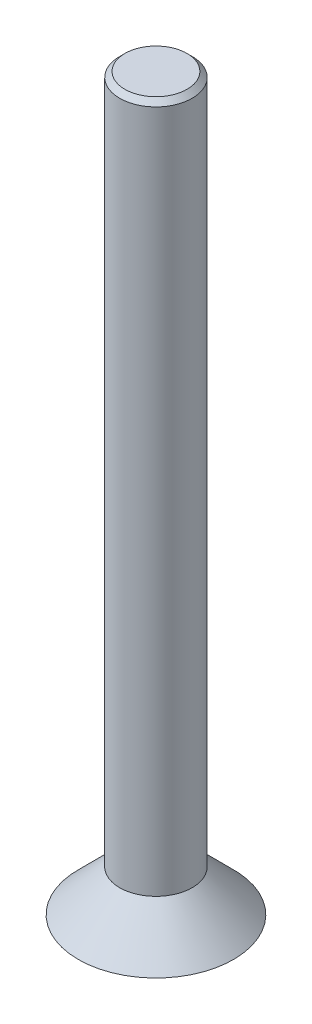
from build123d import *

# Parameters (mm, degrees)
SKETCH_1_R      = 3
EXTRUDE_1_DEPTH = 1.6
CHAMFER_1_SIZE  = 1.6
SKETCH_2_R      = 1.4
EXTRUDE_2_DEPTH = 26.6
CHAMFER_2_SIZE  = 0.2


with BuildPart() as part:
    # 草图1 → 凸台-拉伸1 (new body)
    with BuildSketch(Plane(origin=(0, 0, 0), x_dir=(1, 0, 0), z_dir=(0, 1, 0))):
        with Locations(Location((0, 0, 0), (0, 0, 270))):
            Circle(SKETCH_1_R)
        Polygon((0, -1.154700538), (1, -0.577350269), (1, 0.577350269), (0, 1.154700538), (-1, 0.577350269), (-1, -0.577350269), align=None, mode=Mode.SUBTRACT)
    extrude(amount=EXTRUDE_1_DEPTH)

    # 倒角1
    # the kernel refuses this chamfer: 1.6 mm, written as the material it takes off along each edge
    with BuildSketch(Plane(origin=(0, 1.6, 0), x_dir=(0, 0, 1), z_dir=(-1, 0, 0))) as chamfer_1_piece_1:
        Polygon((3, -CHAMFER_1_SIZE), (3 - CHAMFER_1_SIZE, 0), (3, 0), align=None)
    revolve(axis=Axis((0, 1.6, 0), (0, 1, 0)), mode=Mode.SUBTRACT)

    # 草图2 → 凸台-拉伸2 (add)
    with BuildSketch(Plane(origin=(0, 1.6, 0), x_dir=(1, 0, 0), z_dir=(0, 1, 0))):
        with Locations(Location((0, 0, 0), (0, 0, 270))):
            Circle(SKETCH_2_R)
    extrude(amount=EXTRUDE_2_DEPTH)

    # 倒角2
    chamfer_2_edges = [part.edges().sort_by_distance(p)[0] for p in [
        (0, 28.2, -1.4),
    ]]
    chamfer(chamfer_2_edges, length=CHAMFER_2_SIZE)


solid = part.part
